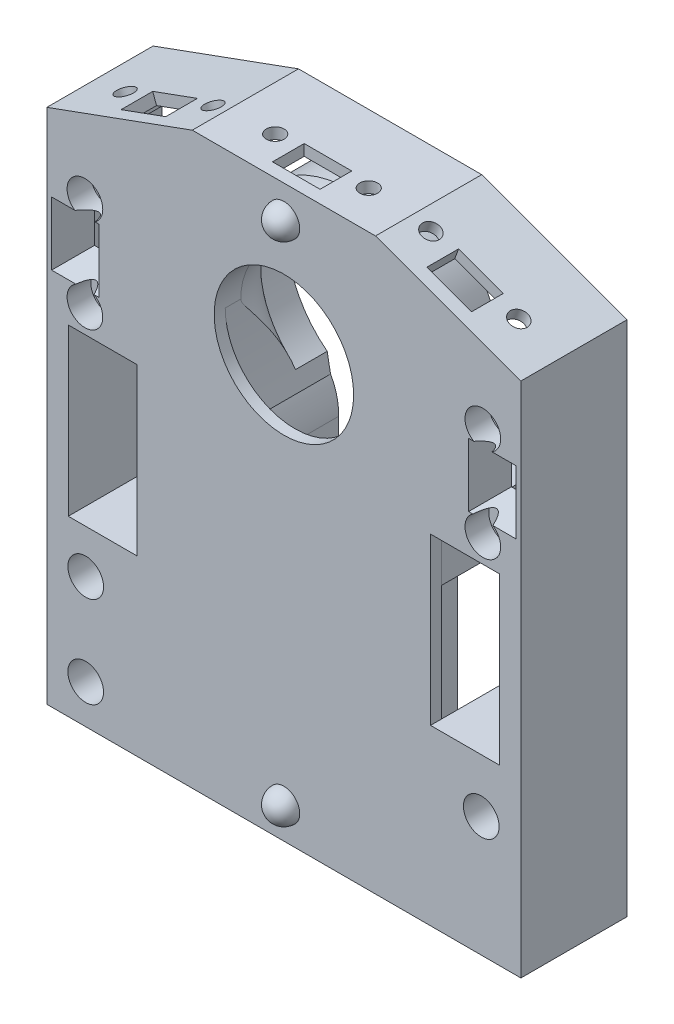
from build123d import *

# Parameters (mm, degrees)
BOSS_EXTRUDE5_DEPTH             = 12
BOSS_EXTRUDE5_2_DEPTH           = 12
BOSS_EXTRUDE5_3_DEPTH           = 12
SKETCH1_6_W                     = 8.7
SKETCH1_6_H                     = 20.9
BOSS_EXTRUDE6_DEPTH             = 1.4
BOSS_EXTRUDE7_DEPTH             = 12
CUT_REVOLVE6_ANGLE              = 90
CUT_REVOLVE6_OTHER_WAY_ANGLE    = 90
SKETCH2_W                       = 3.15
SKETCH2_H                       = 2.6
SKETCH2_W_2                     = 2.6
SKETCH2_H_2                     = 3.3
CUT_EXTRUDE1_DEPTH              = 1
SKETCH2_3_W                     = 6
SKETCH2_3_H                     = 4
CUT_EXTRUDE2_DEPTH              = 1.4
SKETCH3_W                       = 3.15
SKETCH3_H                       = 2.6
SKETCH3_W_2                     = 2.6
SKETCH3_H_2                     = 3.3
CUT_EXTRUDE3_DEPTH              = 1
SKETCH3_3_W                     = 6
SKETCH3_3_H                     = 4
CUT_EXTRUDE4_DEPTH              = 1.4
SKETCH4_W                       = 2.6
SKETCH4_H                       = 3.3
SKETCH4_W_2                     = 3.15
SKETCH4_H_2                     = 2.6
CUT_EXTRUDE5_DEPTH              = 1
SKETCH4_3_W                     = 6
SKETCH4_3_H                     = 4
CUT_EXTRUDE6_DEPTH              = 1.4
SKETCH6_W                       = 2.6
SKETCH6_H                       = 3.15
SKETCH6_W_2                     = 3.3
SKETCH6_H_2                     = 2.6
SKETCH6_H_3                     = 3.6
CUT_EXTRUDE7_DEPTH              = 1
SKETCH6_10_W                    = 14.45
SKETCH6_10_H                    = 17.8
CUT_EXTRUDE9_DEPTH              = 9
SKETCH2_4_R                     = 1.125
CUT_EXTRUDE10_DEPTH             = 1.4
SKETCH3_4_R                     = 1.125
CUT_EXTRUDE11_DEPTH             = 1.4
SKETCH4_4_R                     = 1.125
CUT_EXTRUDE12_DEPTH             = 1.4
SKETCH6_11_R                    = 1.125
CUT_EXTRUDE13_DEPTH             = 1.4
SKETCH9_R                       = 2.25
CUT_EXTRUDE14_DEPTH             = 3
SKETCH10_R                      = 8.8
CUT_EXTRUDE15_DEPTH             = 3.361538462
CUT_EXTRUDE18_START             = -12
CUT_EXTRUDE18_DEPTH             = 12
BOSS_EXTRUDE8_REACH             = 64.366
BOSS_EXTRUDE8_DIRECTION_2_REACH = 64.366
SKETCH15_R                      = 1.75
CUT_EXTRUDE19_DEPTH             = 1.5
SKETCH16_R                      = 1.125
CUT_EXTRUDE20_DEPTH             = 280.454168571
SKETCH16_3_R                    = 2.25
SKETCH16_3_R_2                  = 1.125
CUT_EXTRUDE21_DEPTH             = 280.454168571
SKETCH17_R                      = 1.125
CUT_EXTRUDE22_DEPTH             = 280.476091885
SKETCH17_3_R                    = 2.25
SKETCH17_3_R_2                  = 1.125
CUT_EXTRUDE23_DEPTH             = 280.476091885
REVOLVE1_ANGLE                  = 180
REVOLVE2_ANGLE                  = 180


# Read off the part's stored shape, not the designer's step: Cut-Extrude18
with BuildPart() as part:
    # Sketch1 → Boss-Extrude5 (new body)
    with BuildSketch(Plane.XY):
        Polygon((25.057714582, 53.4), (43.4, 46.723954079), (43.4, -18.5), (-16.4, -18.5), (-16.4, 46.723954079), (1.942285418, 53.4), align=None)
        Polygon((40.9, 42.1), (40.9, 46.144030784), (24.810856809, 52), (2.189143191, 52), (-13.9, 46.144030784), (-13.9, 42.1), (-5, 42.1), (-5, 24.3), (-13.7, 24.3), (-13.7, 3.4), (-5, 3.4), (-5, -17.1), (32, -17.1), (32, 3.4), (40.7, 3.4), (40.7, 24.3), (32, 24.3), (32, 42.1), align=None, mode=Mode.SUBTRACT)
    extrude(amount=-BOSS_EXTRUDE5_DEPTH)

    # Sketch1<6> → Boss-Extrude6 (add)
    with BuildSketch(Plane.XY):
        Polygon((-16.4, 46.723954079), (-16.4, -18.5), (43.4, -18.5), (43.4, 46.723954079), (25.057714582, 53.4), (1.942285418, 53.4), align=None)
        with Locations((-9.35, 13.85)):
            Rectangle(SKETCH1_6_W, SKETCH1_6_H, mode=Mode.SUBTRACT)
        with Locations((36.35, 13.85)):
            Rectangle(SKETCH1_6_W, SKETCH1_6_H, mode=Mode.SUBTRACT)
    extrude(amount=BOSS_EXTRUDE6_DEPTH)

    # Sketch1<7> → Boss-Extrude7 (add)
    with BuildSketch(Plane.XY):
        with BuildLine():
            ThreePointArc((-0.3, 34.65), (0.3489333, 29.319310986), (2.257827487, 24.3))
            ThreePointArc((2.257827487, 24.3), (3.032378525, 22.946162696), (3.9, 21.65))
            ThreePointArc((3.9, 21.65), (4.756017053, 19.917224317), (5, 18))
            Line((5, 18), (5, -17.1))
            Line((5, -17.1), (22, -17.1))
            Line((22, -17.1), (22, 18))
            ThreePointArc((22, 18), (22.243982947, 19.917224317), (23.1, 21.65))
            ThreePointArc((23.1, 21.65), (23.967621475, 22.946162696), (24.742172513, 24.3))
            ThreePointArc((24.742172513, 24.3), (26.6510667, 29.319310986), (27.3, 34.65))
            ThreePointArc((27.3, 34.65), (13.5, 48.45), (-0.3, 34.65))
        make_face()
    extrude(amount=-BOSS_EXTRUDE7_DEPTH)

    # Sketch5 → Cut-Revolve5 (revolve, cut)
    with BuildSketch(Plane(origin=(13.5, 0, 0), x_dir=(0, 0, -1), z_dir=(1, 0, 0)), mode=Mode.PRIVATE) as cut_revolve5_sk:
        with BuildLine():
            Line((12, 34.65), (12, 47.65))
            Line((12, 47.65), (8, 47.65))
            ThreePointArc((8, 47.65), (5.576881737, 44.692951799), (1.961538462, 43.45))
            Line((1.961538462, 43.45), (1.961538462, 34.65))
            Line((1.961538462, 34.65), (12, 34.65))
        make_face()
    revolve(cut_revolve5_sk.sketch.rotate(Axis((13.5, 34.65, 4.059219519), (0, 0, -1)), 270), axis=Axis((13.5, 34.65, 4.059219519), (0, 0, -1)), mode=Mode.SUBTRACT)

    # Sketch5<6> → Cut-Revolve6 (revolve, cut)
    with BuildSketch(Plane(origin=(13.5, 0, 0), x_dir=(0, 0, -1), z_dir=(1, 0, 0))):
        with BuildLine():
            ThreePointArc((7, 48.45), (4.133687718, 45.341046493), (0, 44.45))
            Line((0, 44.45), (0, 48.45))
            Line((0, 48.45), (7, 48.45))
        make_face()
    revolve(axis=Axis((13.5, 34.65, 4.059219519), (0, 0, -1)), revolution_arc=CUT_REVOLVE6_ANGLE, mode=Mode.SUBTRACT)

    # Sketch5<6> → Cut-Revolve6 other way (revolve, cut)
    with BuildSketch(Plane(origin=(13.5, 0, 0), x_dir=(0, 0, -1), z_dir=(1, 0, 0))):
        with BuildLine():
            ThreePointArc((7, 48.45), (4.133687718, 45.341046493), (0, 44.45))
            Line((0, 44.45), (0, 48.45))
            Line((0, 48.45), (7, 48.45))
        make_face()
    revolve(axis=Axis((13.5, 34.65, 4.059219519), (0, 0, 1)), revolution_arc=CUT_REVOLVE6_OTHER_WAY_ANGLE, mode=Mode.SUBTRACT)

    # Sketch2 → Cut-Extrude1 (cut)
    with BuildSketch(Plane(origin=(19.614796763, 53.891211192, 0), x_dir=(0.9396926207859104, -0.3420201433256635, 0), z_dir=(0.3420201433256635, 0.9396926207859104, 0))):
        with Locations((18.336654775, 8.4)):
            Rectangle(SKETCH2_W, SKETCH2_H)
        with Locations((12.411654775, 7.15)):
            Rectangle(SKETCH2_W_2, SKETCH2_H_2)
    extrude(amount=CUT_EXTRUDE1_DEPTH, mode=Mode.SUBTRACT)

    # Sketch2<3> → Cut-Extrude2 (cut)
    with BuildSketch(Plane(origin=(19.614796763, 53.891211192, 0), x_dir=(0.9396926207859104, -0.3420201433256635, 0), z_dir=(0.3420201433256635, 0.9396926207859104, 0))):
        with Locations((13.473654775, 2.2)):
            Rectangle(SKETCH2_3_W, SKETCH2_3_H)
    extrude(amount=CUT_EXTRUDE2_DEPTH, mode=Mode.SUBTRACT)

    # Sketch3 → Cut-Extrude3 (cut)
    with BuildSketch(Plane(origin=(0, 52, 0), x_dir=(1, 0, 0), z_dir=(0, 1, 0))):
        with Locations((18.325, 8.4)):
            Rectangle(SKETCH3_W, SKETCH3_H)
        with Locations((12.4, 7.15)):
            Rectangle(SKETCH3_W_2, SKETCH3_H_2)
    extrude(amount=CUT_EXTRUDE3_DEPTH, mode=Mode.SUBTRACT)

    # Sketch3<3> → Cut-Extrude4 (cut)
    with BuildSketch(Plane(origin=(0, 52, 0), x_dir=(1, 0, 0), z_dir=(0, 1, 0))):
        with Locations((13.462, 2.2)):
            Rectangle(SKETCH3_3_W, SKETCH3_3_H)
    extrude(amount=CUT_EXTRUDE4_DEPTH, mode=Mode.SUBTRACT)

    # Sketch4 → Cut-Extrude5 (cut)
    with BuildSketch(Plane(origin=(-16.456396745, 45.213578462, 0), x_dir=(0.9396926207859104, 0.34202014332566316, 0), z_dir=(-0.34202014332566316, 0.9396926207859104, 0))):
        with Locations((10.760045986, 7.15)):
            Rectangle(SKETCH4_W, SKETCH4_H)
        with Locations((16.685045986, 8.4)):
            Rectangle(SKETCH4_W_2, SKETCH4_H_2)
    extrude(amount=CUT_EXTRUDE5_DEPTH, mode=Mode.SUBTRACT)

    # Sketch4<3> → Cut-Extrude6 (cut)
    with BuildSketch(Plane(origin=(-16.456396745, 45.213578462, 0), x_dir=(0.9396926207859104, 0.34202014332566316, 0), z_dir=(-0.34202014332566316, 0.9396926207859104, 0))):
        with Locations((11.822045986, 2.2)):
            Rectangle(SKETCH4_3_W, SKETCH4_3_H)
    extrude(amount=CUT_EXTRUDE6_DEPTH, mode=Mode.SUBTRACT)

    # Sketch6 → Cut-Extrude7 (cut)
    with BuildSketch(Plane.XY.offset(-3)):
        with Locations((33.6, 38.025)):
            Rectangle(SKETCH6_W, SKETCH6_H)
        with Locations((34.85, 32.1)):
            Rectangle(SKETCH6_W_2, SKETCH6_H_2)
        with Locations((-7.85, 34.3)):
            Rectangle(SKETCH6_W_2, SKETCH6_H_2)
        with Locations((-6.6, 28.6)):
            Rectangle(SKETCH6_W, SKETCH6_H_3)
    extrude(amount=CUT_EXTRUDE7_DEPTH, mode=Mode.SUBTRACT)

    # Sketch6<8> → Cut-Loft3 section 0
    with BuildSketch(Plane.XY.offset(-3)):
        with BuildLine():
            Line((37.8, 36.162), (41.8, 36.162))
            Line((41.8, 36.162), (41.8, 30.162))
            Line((41.8, 30.162), (37.8, 30.162))
            Line((37.8, 30.162), (37.8, 36.162))
        make_face()
    # Sketch8<7> → Cut-Loft3 section 1
    with BuildSketch(Plane.XY.offset(1.4)):
        with BuildLine():
            Line((36.8, 37.162), (42.8, 37.162))
            Line((42.8, 37.162), (42.8, 29.162))
            Line((42.8, 29.162), (36.8, 29.162))
            Line((36.8, 29.162), (36.8, 37.162))
        make_face()
    loft(mode=Mode.SUBTRACT)

    # Sketch6<9> → Cut-Loft4 section 0
    with BuildSketch(Plane.XY.offset(-3)):
        with BuildLine():
            Line((-14.8, 36.238), (-10.8, 36.238))
            Line((-10.8, 36.238), (-10.8, 30.238))
            Line((-10.8, 30.238), (-14.8, 30.238))
            Line((-14.8, 30.238), (-14.8, 36.238))
        make_face()
    # Sketch8<6> → Cut-Loft4 section 1
    with BuildSketch(Plane.XY.offset(1.4)):
        with BuildLine():
            Line((-9.8, 29.238), (-15.8, 29.238))
            Line((-15.8, 29.238), (-15.8, 37.238))
            Line((-15.8, 37.238), (-9.8, 37.238))
            Line((-9.8, 37.238), (-9.8, 29.238))
        make_face()
    loft(mode=Mode.SUBTRACT)

    # Sketch6<10> → Cut-Extrude9 (cut)
    with BuildSketch(Plane.XY.offset(-3)):
        with Locations((35.025, 33.2)):
            Rectangle(SKETCH6_10_W, SKETCH6_10_H)
        with Locations((-8.025, 33.2)):
            Rectangle(SKETCH6_10_W, SKETCH6_10_H)
    extrude(amount=-CUT_EXTRUDE9_DEPTH, mode=Mode.SUBTRACT)

    # Sketch2<4> → Cut-Extrude10 (cut)
    with BuildSketch(Plane(origin=(19.614796763, 53.891211192, 0), x_dir=(0.9396926207859104, -0.3420201433256635, 0), z_dir=(0.3420201433256635, 0.9396926207859104, 0))):
        with Locations((19.411654775, 3.4)):
            Circle(SKETCH2_4_R)
        with Locations((7.611654775, 3.4)):
            Circle(SKETCH2_4_R)
    extrude(amount=CUT_EXTRUDE10_DEPTH, mode=Mode.SUBTRACT)

    # Sketch3<4> → Cut-Extrude11 (cut)
    with BuildSketch(Plane(origin=(0, 52, 0), x_dir=(1, 0, 0), z_dir=(0, 1, 0))):
        with Locations(Location((19.4, 3.4, 0), (0, 0, 90))):
            Circle(SKETCH3_4_R)
        with Locations(Location((7.6, 3.4, 0), (0, 0, 90))):
            Circle(SKETCH3_4_R)
    extrude(amount=CUT_EXTRUDE11_DEPTH, mode=Mode.SUBTRACT)

    # Sketch4<4> → Cut-Extrude12 (cut)
    with BuildSketch(Plane(origin=(-16.456396745, 45.213578462, 0), x_dir=(0.9396926207859104, 0.34202014332566316, 0), z_dir=(-0.34202014332566316, 0.9396926207859104, 0))):
        with Locations(Location((17.760045986, 3.4, 0), (0, 0, 180))):
            Circle(SKETCH4_4_R)
        with Locations(Location((5.960045986, 3.4, 0), (0, 0, 180))):
            Circle(SKETCH4_4_R)
    extrude(amount=CUT_EXTRUDE12_DEPTH, mode=Mode.SUBTRACT)

    # Sketch6<11> → Cut-Extrude13 (cut)
    with BuildSketch(Plane.XY.offset(-3)):
        with Locations((-11.6, 39.1)):
            Circle(SKETCH6_11_R)
        with Locations((-11.6, 27.3)):
            Circle(SKETCH6_11_R)
        with Locations((38.6, 39.1)):
            Circle(SKETCH6_11_R)
        with Locations((38.6, 27.3)):
            Circle(SKETCH6_11_R)
    extrude(amount=CUT_EXTRUDE13_DEPTH, mode=Mode.SUBTRACT)

    # Sketch9 → Cut-Extrude14 (cut)
    with BuildSketch(Plane.XY.offset(1.4)):
        with Locations(Location((-11.6, 39.1, 0), (0, 0, 304.151552798))):
            Circle(SKETCH9_R)
        with Locations(Location((-11.6, 27.3, 0), (0, 0, 59.466620714))):
            Circle(SKETCH9_R)
        with Locations(Location((38.6, 39.1, 0), (0, 0, 300.533379286))):
            Circle(SKETCH9_R)
        with Locations(Location((38.6, 27.3, 0), (0, 0, 55.848447202))):
            Circle(SKETCH9_R)
    extrude(amount=-CUT_EXTRUDE14_DEPTH, mode=Mode.SUBTRACT)

    # Sketch10 → Cut-Extrude15 (cut)
    with BuildSketch(Plane.XY.offset(1.4)):
        with Locations((13.5, 34.65)):
            Circle(SKETCH10_R)
    extrude(amount=-CUT_EXTRUDE15_DEPTH, mode=Mode.SUBTRACT)

    # Cut-Extrude18 outline → Cut-Extrude18 (cut)
    with BuildSketch(Plane(origin=(0, 0, -12), x_dir=(-1, 0, 0), z_dir=(0, 0, -1)).offset(CUT_EXTRUDE18_START)):
        with BuildLine():
            ThreePointArc((-7, 17.963344958), (-6.780572857, 20.092182234), (-5.993883714, 22.082462769))
            ThreePointArc((-5.993883714, 22.082462769), (-5.024323582, 28.333016402), (-4.7, 34.65))
            ThreePointArc((-4.7, 34.65), (-13.500000003, 25.85), (-22.3, 34.650000005))
            ThreePointArc((-22.3, 34.650000005), (-21.975676418, 28.333016404), (-21.006116286, 22.082462769))
            ThreePointArc((-21.006116286, 22.082462769), (-20.219427143, 20.092182234), (-20, 17.963344958))
            Line((-20, 17.963344958), (-20, -18.5))
            Line((-20, -18.5), (-7, -18.5))
            Line((-7, -18.5), (-7, 17.963344958))
        make_face()
    extrude(amount=CUT_EXTRUDE18_DEPTH, mode=Mode.SUBTRACT)

    # Boss-Extrude8: up to this face of the body (flat: up to its plane)
    boss_extrude8_end = Plane(part.part.faces().sort_by_distance((20, -0.268327521, -6))[0])
    # Sketch14 → Boss-Extrude8 (add, up to the picked face)
    with BuildSketch(Plane(origin=(13.5, 0, 0), x_dir=(0, 0, -1), z_dir=(1, 0, 0)), mode=Mode.PRIVATE) as boss_extrude8_sk1:
        with BuildLine():
            Line((0, 18), (0, 9))
            Line((0, 9), (5, 9))
            ThreePointArc((5, 9), (4.386653927, 10.995895877), (3.05, 12.6))
            ThreePointArc((3.05, 12.6), (0.913784363, 14.954776353), (0, 18))
        make_face()
    boss_extrude8_tool1 = split(extrude(boss_extrude8_sk1.sketch, amount=BOSS_EXTRUDE8_REACH, mode=Mode.PRIVATE), bisect_by=boss_extrude8_end, keep=Keep.BOTH, mode=Mode.PRIVATE)
    add(boss_extrude8_tool1.solids().sort_by(Axis((13.5, 11.509312, -1.867244), (1, 0, 0)))[0])

    # Boss-Extrude8 direction 2: up to this face of the body (flat: up to its plane)
    boss_extrude8_direction_2_end = Plane(part.part.faces().sort_by_distance((7, -0.268327521, -6))[0])
    # Sketch14 → Boss-Extrude8 direction 2 (add, up to the picked face)
    with BuildSketch(Plane(origin=(13.5, 0, 0), x_dir=(0, 0, -1), z_dir=(1, 0, 0)), mode=Mode.PRIVATE) as boss_extrude8_direction_2_sk1:
        with BuildLine():
            Line((0, 18), (0, 9))
            Line((0, 9), (5, 9))
            ThreePointArc((5, 9), (4.386653927, 10.995895877), (3.05, 12.6))
            ThreePointArc((3.05, 12.6), (0.913784363, 14.954776353), (0, 18))
        make_face()
    boss_extrude8_direction_2_tool1 = split(extrude(boss_extrude8_direction_2_sk1.sketch, amount=-BOSS_EXTRUDE8_DIRECTION_2_REACH, mode=Mode.PRIVATE), bisect_by=boss_extrude8_direction_2_end, keep=Keep.BOTH, mode=Mode.PRIVATE)
    add(boss_extrude8_direction_2_tool1.solids().sort_by(Axis((13.5, 11.509312, -1.867244), (-1, 0, 0)))[0])

    # Sketch15 → Cut-Extrude19 (cut)
    with BuildSketch(Plane.XZ.offset(-9)):
        with Locations((17, -2.5)):
            Circle(SKETCH15_R)
        with Locations((10, -2.5)):
            Circle(SKETCH15_R)
    extrude(amount=-CUT_EXTRUDE19_DEPTH, mode=Mode.SUBTRACT)

    # Sketch16 → Cut-Extrude20 (cut, through all)
    with BuildSketch(Plane(origin=(219.839551417, 130.546793579, -3.6), x_dir=(-1, 0, 0), z_dir=(0, 0, -1))):
        with Locations(Location((181.439551417, -133.896793579, 0), (0, 0, 90))):
            Circle(SKETCH16_R)
    extrude(amount=CUT_EXTRUDE20_DEPTH, mode=Mode.SUBTRACT)

    # Sketch16<3> → Cut-Extrude21 (cut, through all)
    # profile 1 of 2: a face of its own
    with BuildSketch(Plane(origin=(219.839551417, 130.546793579, -3.6), x_dir=(-1, 0, 0), z_dir=(0, 0, -1))):
        with Locations(Location((181.439551417, -133.896793579, 0), (0, 0, 90))):
            Circle(SKETCH16_3_R)
        with Locations(Location((181.439551417, -133.896793579, 0), (0, 0, 90))):
            Circle(SKETCH16_3_R_2, mode=Mode.SUBTRACT)
    # profile 2 of 2: a face of its own
    with BuildSketch(Plane(origin=(219.839551417, 130.546793579, -3.6), x_dir=(-1, 0, 0), z_dir=(0, 0, -1))):
        with Locations(Location((181.439551417, -133.896793579, 0), (0, 0, 90))):
            Circle(SKETCH16_3_R_2)
    extrude(amount=-CUT_EXTRUDE21_DEPTH, mode=Mode.SUBTRACT)

    # Sketch17 → Cut-Extrude22 (cut, through all)
    with BuildSketch(Plane(origin=(219.839551417, 130.546793579, -7.700198), x_dir=(-1, 0, 0), z_dir=(0, 0, -1))):
        with Locations(Location((231.339551417, -132.646793579, 0), (0, 0, 270))):
            Circle(SKETCH17_R)
        with Locations(Location((231.339551417, -144.146793579, 0), (0, 0, 270))):
            Circle(SKETCH17_R)
    extrude(amount=CUT_EXTRUDE22_DEPTH, mode=Mode.SUBTRACT)

    # Sketch17<3> → Cut-Extrude23 (cut, through all)
    # profile 1 of 4: a face of its own
    with BuildSketch(Plane(origin=(219.839551417, 130.546793579, -7.700198), x_dir=(-1, 0, 0), z_dir=(0, 0, -1))):
        with Locations(Location((231.339551417, -132.646793579, 0), (0, 0, 90))):
            Circle(SKETCH17_3_R)
        with Locations(Location((231.339551417, -132.646793579, 0), (0, 0, 270))):
            Circle(SKETCH17_3_R_2, mode=Mode.SUBTRACT)
    # profile 2 of 4: a face of its own
    with BuildSketch(Plane(origin=(219.839551417, 130.546793579, -7.700198), x_dir=(-1, 0, 0), z_dir=(0, 0, -1))):
        with Locations(Location((231.339551417, -132.646793579, 0), (0, 0, 270))):
            Circle(SKETCH17_3_R_2)
    # profile 3 of 4: a face of its own
    with BuildSketch(Plane(origin=(219.839551417, 130.546793579, -7.700198), x_dir=(-1, 0, 0), z_dir=(0, 0, -1))):
        with Locations(Location((231.339551417, -144.146793579, 0), (0, 0, 90))):
            Circle(SKETCH17_3_R)
        with Locations(Location((231.339551417, -144.146793579, 0), (0, 0, 270))):
            Circle(SKETCH17_3_R_2, mode=Mode.SUBTRACT)
    # profile 4 of 4: a face of its own
    with BuildSketch(Plane(origin=(219.839551417, 130.546793579, -7.700198), x_dir=(-1, 0, 0), z_dir=(0, 0, -1))):
        with Locations(Location((231.339551417, -144.146793579, 0), (0, 0, 270))):
            Circle(SKETCH17_3_R_2)
    extrude(amount=-CUT_EXTRUDE23_DEPTH, mode=Mode.SUBTRACT)

    # Sketch18 → Revolve1 (revolve)
    with BuildSketch(Plane.XY.offset(1.4)):
        with BuildLine():
            Line((11.5, 49.4), (15.5, 49.4))
            ThreePointArc((15.5, 49.4), (13.5, 51.4), (11.5, 49.4))
        make_face()
    revolve(axis=Axis((11.5, 49.4, 1.4), (1, 0, 0)), revolution_arc=REVOLVE1_ANGLE)

    # Sketch18<3> → Revolve2 (revolve)
    with BuildSketch(Plane.XY.offset(1.4)):
        with BuildLine():
            Line((11.5, -14.5), (15.5, -14.5))
            ThreePointArc((15.5, -14.5), (13.5, -12.5), (11.5, -14.5))
        make_face()
    revolve(axis=Axis((11.5, -14.5, 1.4), (1, 0, 0)), revolution_arc=REVOLVE2_ANGLE)


with BuildPart() as body_2:
    # Sketch1 → Boss-Extrude5 2 (new body)
    with BuildSketch(Plane.XY):
        with BuildLine():
            Line((2.257827487, 24.3), (-5, 24.3))
            Line((-5, 24.3), (-5, 18))
            Line((-5, 18), (5, 18))
            ThreePointArc((5, 18), (4.756017053, 19.917224317), (3.9, 21.65))
            ThreePointArc((3.9, 21.65), (3.032378525, 22.946162696), (2.257827487, 24.3))
        make_face()
    extrude(amount=-BOSS_EXTRUDE5_2_DEPTH)


with BuildPart() as body_3:
    # Sketch1 → Boss-Extrude5 3 (new body)
    with BuildSketch(Plane.XY):
        with BuildLine():
            Line((32, 24.3), (24.742172513, 24.3))
            ThreePointArc((24.742172513, 24.3), (23.967621475, 22.946162696), (23.1, 21.65))
            ThreePointArc((23.1, 21.65), (22.243982947, 19.917224317), (22, 18))
            Line((22, 18), (32, 18))
            Line((32, 18), (32, 24.3))
        make_face()
    extrude(amount=-BOSS_EXTRUDE5_3_DEPTH)


solid = Compound([part.part, body_2.part, body_3.part])
